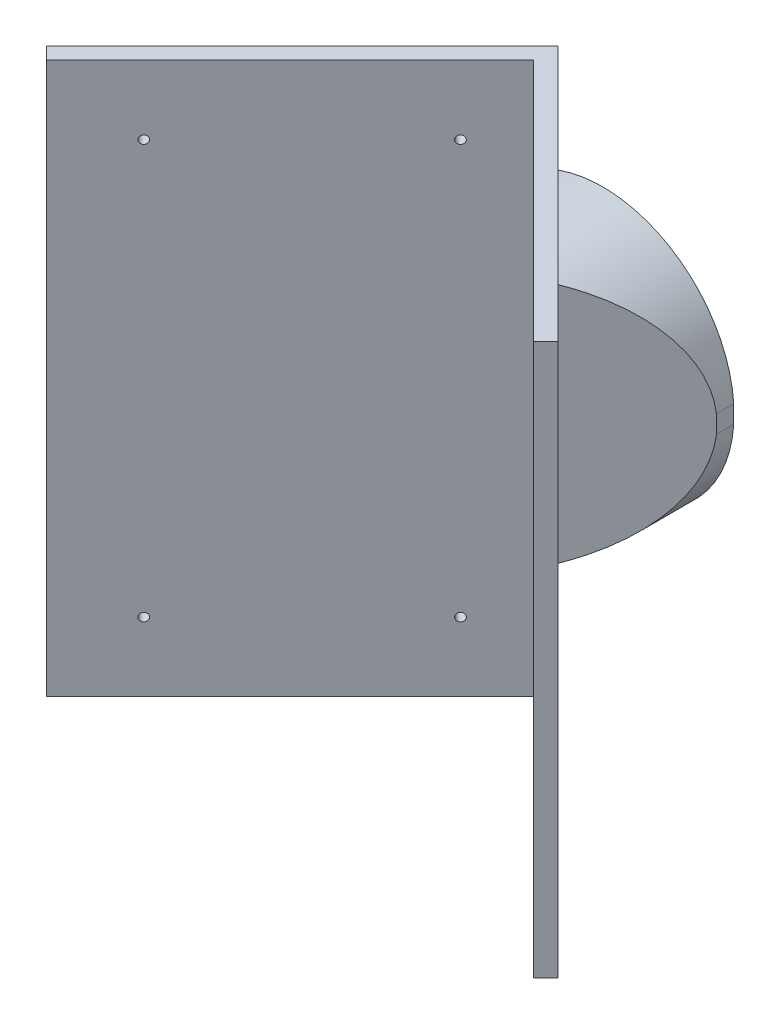
from build123d import *

# Parameters (mm, degrees)
BOSS_EXTRUDE1_START                             = -38.1
BOSS_EXTRUDE1_DEPTH                             = 76.2
BOSS_EXTRUDE1_START_2                           = 20
BOSS_EXTRUDE1_2_DEPTH                           = 29
BOSS_EXTRUDE2_DEPTH                             = 80
CSK_FOR_M2_FLAT_HEAD_MACHINE_SCREW1_D           = 2.4
CSK_FOR_M2_FLAT_HEAD_MACHINE_SCREW1_CSINK_D     = 4.4
CSK_FOR_M2_FLAT_HEAD_MACHINE_SCREW1_CSINK_ANGLE = 90


with BuildPart() as part:
    # Boss-Extrude1: read off the stored shape, not the designer's step
    # Boss-Extrude1 outline → Boss-Extrude1 (new body)
    with BuildSketch(Plane(origin=(0, 0, 0), x_dir=(1, 0, 0), z_dir=(0, 1, 0)).offset(BOSS_EXTRUDE1_START)):
        Polygon((-15, -48.011182565), (0, -33.011182565), (15, -48.011182565), (38.011182565, -25), (38.011182565, -20), (-38.011182565, -20), (-38.011182565, -25), align=None)
    extrude(amount=BOSS_EXTRUDE1_DEPTH)

    # Boss-Extrude1 2 outline → Boss-Extrude1 2 (cut)
    with BuildSketch(Plane.XY.offset(BOSS_EXTRUDE1_START_2)):
        with BuildLine():
            ThreePointArc((0, 38.1), (26.005287924, 27.844837942), (38.011182565, 2.6))
            Line((38.011182565, 2.6), (38.011182565, 38.1))
            Line((38.011182565, 38.1), (0, 38.1))
        make_face()
        with BuildLine():
            ThreePointArc((-38.011182565, 2.6), (-26.005287924, 27.844837942), (0, 38.1))
            Line((0, 38.1), (-38.011182565, 38.1))
            Line((-38.011182565, 38.1), (-38.011182565, 2.6))
        make_face()
        with BuildLine():
            Line((38.011182565, -38.1), (38.011182565, -2.6))
            ThreePointArc((38.011182565, -2.6), (26.005287924, -27.844837942), (0, -38.1))
            Line((0, -38.1), (38.011182565, -38.1))
        make_face()
        with BuildLine():
            Line((-38.011182565, -38.1), (0, -38.1))
            ThreePointArc((0, -38.1), (-26.005287924, -27.844837942), (-38.011182565, -2.6))
            Line((-38.011182565, -2.6), (-38.011182565, -38.1))
        make_face()
    extrude(amount=BOSS_EXTRUDE1_2_DEPTH, mode=Mode.SUBTRACT)

    # Sketch1<3> → Boss-Extrude2 (add, symmetric)
    with BuildSketch(Plane(origin=(0, 0, 0), x_dir=(1, 0, 0), z_dir=(0, 1, 0))):
        Polygon((0, -33.011182565), (15, -48.011182565), (74.246212025, -107.25739459), (70.710678119, -110.792928496), (0, -40.082250377), (-70.710678119, -110.792928496), (-74.246212025, -107.25739459), (-15, -48.011182565), align=None)
    extrude(amount=BOSS_EXTRUDE2_DEPTH, both=True)

    # CSK for M2 Flat Head Machine Screw1 (through all)
    with Locations(Plane(origin=(16.505591283, 0, 16.505591283), x_dir=(-0.7071067811865441, 0, 0.7071067811865509), z_dir=(-0.7071067811865509, 0, -0.7071067811865441))):
        with Locations((108.342431047, 60), (43.342431047, 60), (43.342431047, -60), (108.342431047, -60)):
            csk_for_m2_flat_head_machine_screw1 = CounterSinkHole(CSK_FOR_M2_FLAT_HEAD_MACHINE_SCREW1_D / 2, CSK_FOR_M2_FLAT_HEAD_MACHINE_SCREW1_CSINK_D / 2, counter_sink_angle=CSK_FOR_M2_FLAT_HEAD_MACHINE_SCREW1_CSINK_ANGLE)

    # Mirror1: CSK for M2 Flat Head Machine Screw1 across plane
    add(csk_for_m2_flat_head_machine_screw1.mirror(Plane(origin=(0, 0, 0), x_dir=(0, 0, 1), z_dir=(1, 0, 0))), mode=Mode.SUBTRACT)


solid = part.part
